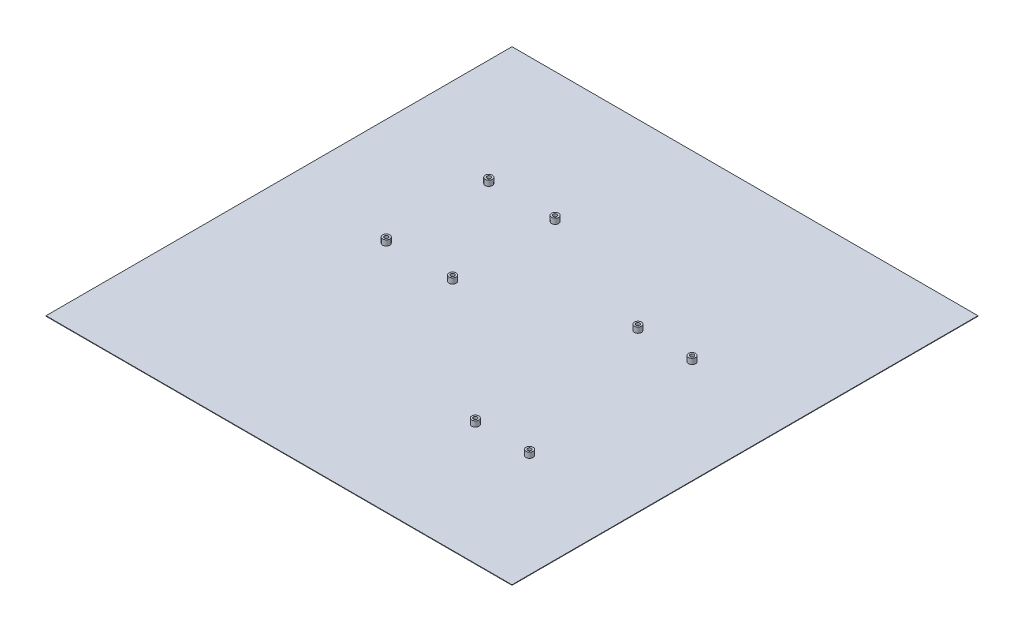
from build123d import *

# Parameters (mm, degrees)
SKETCH1_W           = 430
SKETCH1_H           = 430
BOSS_EXTRUDE1_DEPTH = 0.45
SKETCH7_R           = 3.3
BOSS_EXTRUDE2_DEPTH = 5
SKETCH8_R           = 1.75
CUT_EXTRUDE1_DEPTH  = 4
SKETCH6_R           = 3.3
BOSS_EXTRUDE3_DEPTH = 5
SKETCH10_R          = 1.75
CUT_EXTRUDE2_DEPTH  = 4


with BuildPart() as part:
    # Sketch1 → Boss-Extrude1 (new body)
    with BuildSketch(Plane(origin=(0, 0, 0), x_dir=(1, 0, 0), z_dir=(0, 1, 0))):
        Rectangle(SKETCH1_W, SKETCH1_H)
    extrude(amount=BOSS_EXTRUDE1_DEPTH)

    # Sketch7 → Boss-Extrude2 (add)
    with BuildSketch(Plane(origin=(0, 0.45, 0), x_dir=(1, 0, 0), z_dir=(0, 1, 0))):
        with Locations((-116.362714529, 94.945868521)):
            Circle(SKETCH7_R)
        with Locations((-55.363204635, 95.191638193)):
            Circle(SKETCH7_R)
        with Locations((-54.980448566, 0.192396061)):
            Circle(SKETCH7_R)
        with Locations((-115.97995846, -0.053373612)):
            Circle(SKETCH7_R)
    extrude(amount=BOSS_EXTRUDE2_DEPTH)

    # Sketch8 → Cut-Extrude1 (cut)
    with BuildSketch(Plane(origin=(0, 5.45, 0), x_dir=(1, 0, 0), z_dir=(0, 1, 0))):
        with Locations((-54.980448566, 0.192396061)):
            Circle(SKETCH8_R)
        with Locations((-55.363204635, 95.191638193)):
            Circle(SKETCH8_R)
        with Locations((-116.362714529, 94.945868521)):
            Circle(SKETCH8_R)
        with Locations((-115.97995846, -0.053373612)):
            Circle(SKETCH8_R)
    extrude(amount=-CUT_EXTRUDE1_DEPTH, mode=Mode.SUBTRACT)

    # Sketch6 → Boss-Extrude3 (add)
    with BuildSketch(Plane(origin=(0, 0.45, 0), x_dir=(1, 0, 0), z_dir=(0, 1, 0))):
        with Locations((119.793345796, 46.373061352)):
            Circle(SKETCH6_R)
        with Locations((69.793345796, 46.373061352)):
            Circle(SKETCH6_R)
        with Locations((119.793345796, -103.626938648)):
            Circle(SKETCH6_R)
        with Locations((69.793345796, -103.626938648)):
            Circle(SKETCH6_R)
    extrude(amount=BOSS_EXTRUDE3_DEPTH)

    # Sketch10 → Cut-Extrude2 (cut)
    with BuildSketch(Plane(origin=(0, 5.45, 0), x_dir=(1, 0, 0), z_dir=(0, 1, 0))):
        with Locations((69.793345796, 46.373061352)):
            Circle(SKETCH10_R)
        with Locations((119.793345796, 46.373061352)):
            Circle(SKETCH10_R)
        with Locations((119.793345796, -103.626938648)):
            Circle(SKETCH10_R)
        with Locations((69.793345796, -103.626938648)):
            Circle(SKETCH10_R)
    extrude(amount=-CUT_EXTRUDE2_DEPTH, mode=Mode.SUBTRACT)


solid = part.part
